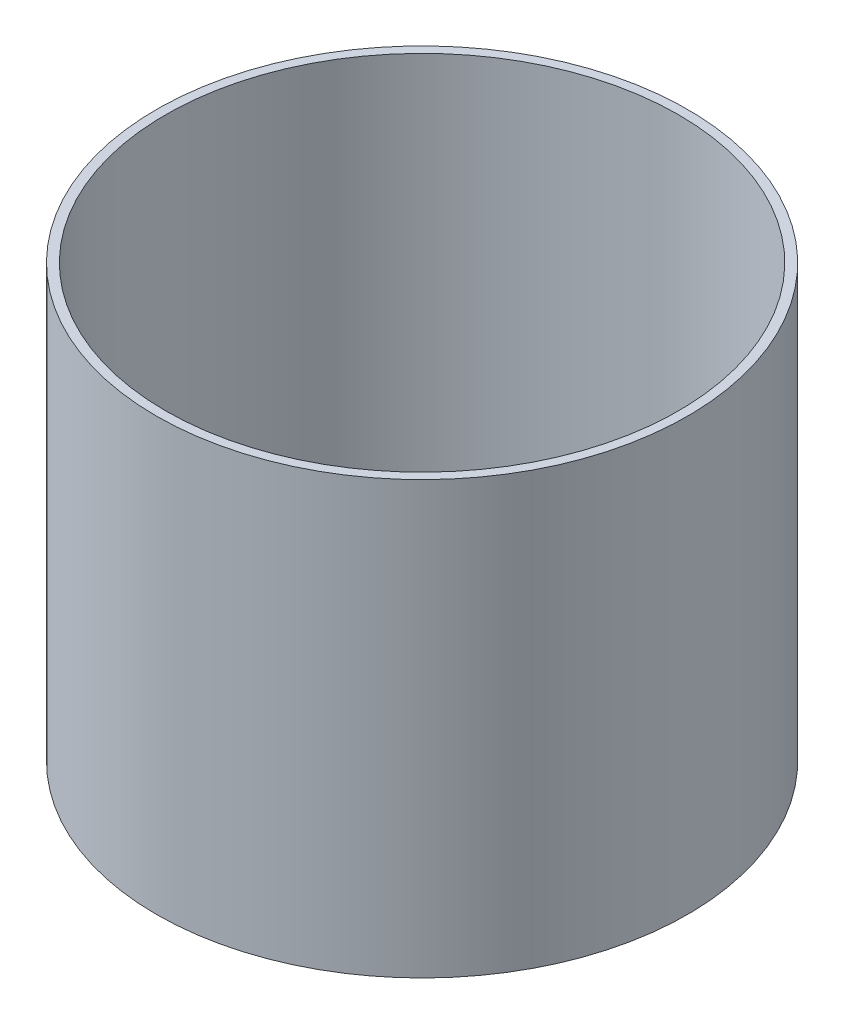
from build123d import *

# Parameters (mm, degrees)
SKETCH1_R           = 109.5375
SKETCH1_R_2         = 105.7783
BOSS_EXTRUDE1_DEPTH = 89


with BuildPart() as part:
    # Sketch1 → Boss-Extrude1 (new, symmetric)
    with BuildSketch(Plane(origin=(0, 0, 0), x_dir=(1, 0, 0), z_dir=(0, 1, 0))):
        Circle(SKETCH1_R)
        Circle(SKETCH1_R_2, mode=Mode.SUBTRACT)
    extrude(amount=BOSS_EXTRUDE1_DEPTH, both=True)


solid = part.part
